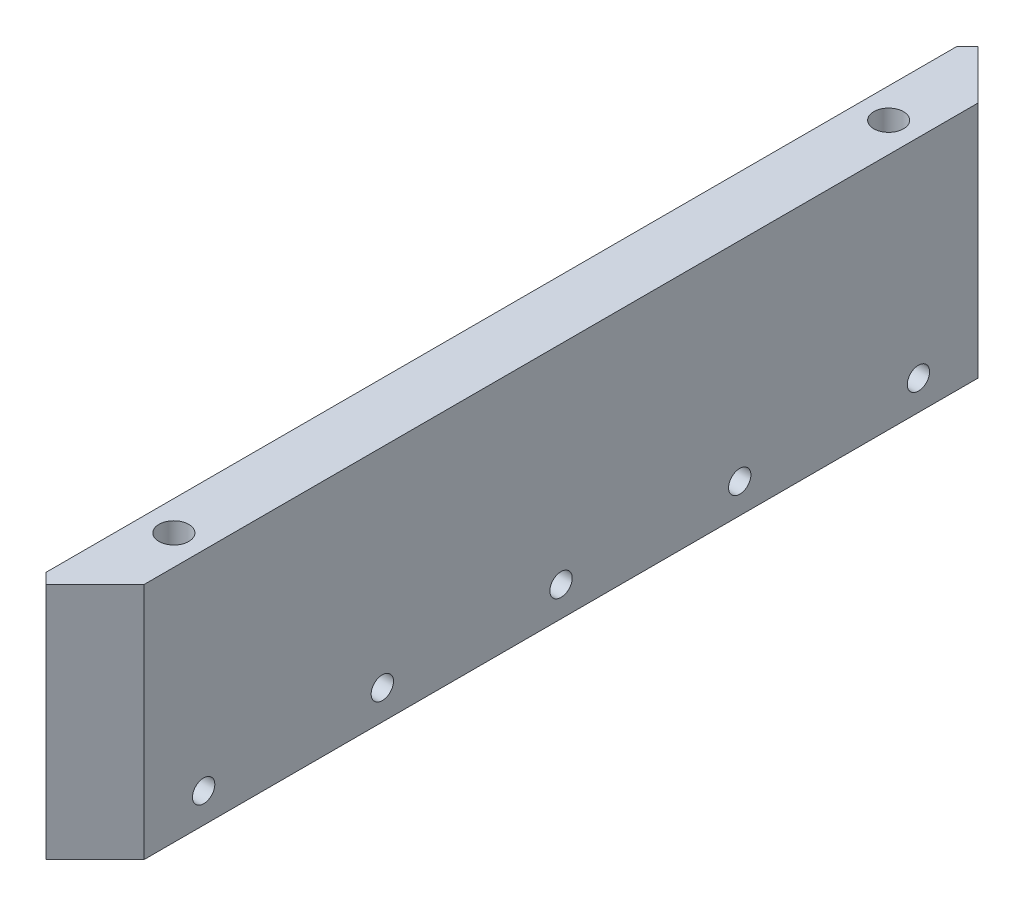
from build123d import *

# Parameters (mm, degrees)
SKETCH1_W           = 203.2
SKETCH1_H           = 50.8
BOSS_EXTRUDE1_DEPTH = 12.7
CUT_EXTRUDE1_DEPTH  = 115.3
CUT_EXTRUDE2_DEPTH  = 115.3
SKETCH4_R           = 2.38125
CUT_EXTRUDE3_DEPTH  = 104.33369877
LPATTERN1_COUNT     = 5
LPATTERN1_PITCH     = 38.1
SKETCH5_R           = 3.175
CUT_EXTRUDE4_DEPTH  = 12.7


with BuildPart() as part:
    # Sketch1 → Boss-Extrude1 (new body)
    with BuildSketch(Plane(origin=(0, 0, 0), x_dir=(0, 0, -1), z_dir=(1, 0, 0))):
        Rectangle(SKETCH1_W, SKETCH1_H)
    extrude(amount=BOSS_EXTRUDE1_DEPTH)

    # Sketch2 → Cut-Extrude1 (cut, through all)
    with BuildSketch(Plane(origin=(0, 25.4, 0), x_dir=(1, 0, 0), z_dir=(0, 1, 0))):
        Polygon((0, 101.6), (12.7, 88.9), (12.7, 101.6), align=None)
        Polygon((0, -101.6), (12.7, -88.9), (12.7, -101.6), align=None)
    extrude(amount=-CUT_EXTRUDE1_DEPTH, mode=Mode.SUBTRACT)

    # Sketch3 → Cut-Extrude2 (cut, through all)
    with BuildSketch(Plane(origin=(0, 25.4, 0), x_dir=(1, 0, 0), z_dir=(0, 1, 0))):
        Polygon((0, 97.109871939), (2.24506403, 99.35493597), (0, 101.6), align=None)
        Polygon((0, -97.109871939), (2.24506403, -99.35493597), (0, -101.6), align=None)
    extrude(amount=-CUT_EXTRUDE2_DEPTH, mode=Mode.SUBTRACT)

    # Sketch4 → Cut-Extrude3 (cut, through all)
    with BuildSketch(Plane.ZY):
        with Locations((-76.2, -19.05)):
            Circle(SKETCH4_R)
    cut_extrude3 = extrude(amount=-CUT_EXTRUDE3_DEPTH, mode=Mode.SUBTRACT)

    # LPattern1: Cut-Extrude3 ×5
    with Locations(*[(0, 0, i * LPATTERN1_PITCH) for i in range(1, LPATTERN1_COUNT)]):
        add(cut_extrude3, mode=Mode.SUBTRACT)

    # Sketch5 → Cut-Extrude4 (cut)
    with BuildSketch(Plane(origin=(0, 25.4, 0), x_dir=(1, 0, 0), z_dir=(0, 1, 0))):
        with Locations((6.35, 76.2)):
            Circle(SKETCH5_R)
        with Locations((6.35, -76.2)):
            Circle(SKETCH5_R)
    extrude(amount=-CUT_EXTRUDE4_DEPTH, mode=Mode.SUBTRACT)


solid = part.part
